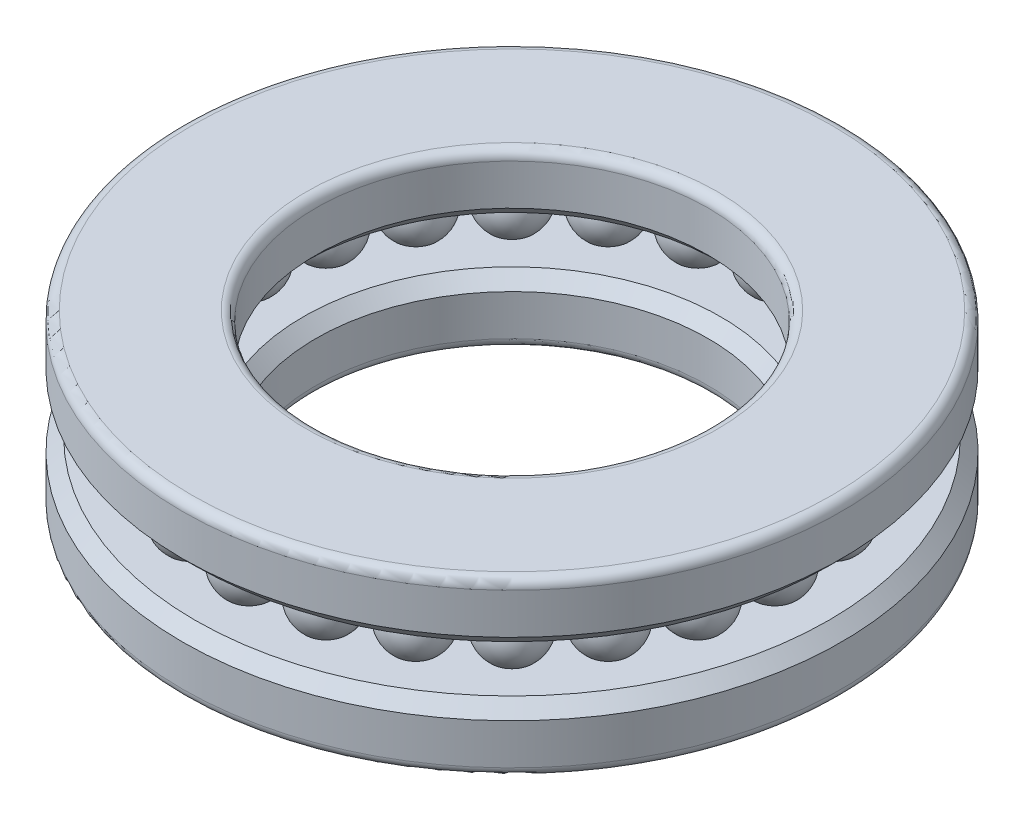
from build123d import *

# Parameters (mm, degrees)
SKETCH3_W         = 8.5
SKETCH3_H         = 4
CIRPATTERN2_COUNT = 24
FILLET1_R         = 0.6
CHAMFER1_SIZE     = 0.8


with BuildPart() as part:
    # Sketch1 → Revolve4 (revolve)
    with BuildSketch(Plane(origin=(0, 0, 0), x_dir=(0, 0, -1), z_dir=(1, 0, 0))):
        with BuildLine():
            Line((-16.75, 2), (-16.75, -2))
            ThreePointArc((-16.75, -2), (-18.75, 0), (-16.75, 2))
        make_face()
    revolve4 = revolve(axis=Axis((0, 0, 16.75), (0, 1, 0)))

    # Sketch3 → Revolve5 (revolve)
    with BuildSketch(Plane(origin=(0, 0, 0), x_dir=(0, 0, -1), z_dir=(1, 0, 0))):
        with Locations((-16.75, 3.5)):
            Rectangle(SKETCH3_W, SKETCH3_H)
        with Locations((-16.75, -3.5)):
            Rectangle(SKETCH3_W, SKETCH3_H)
    revolve(axis=Axis((0, 0, 0), (0, 1, 0)))

    # CirPattern2: Revolve4 ×24 about axis
    cirpattern2_axis = Axis((0, 5.5, 0), (0, -1, 0))
    for i in range(1, CIRPATTERN2_COUNT):
        add(revolve4.rotate(cirpattern2_axis, i * 360 / CIRPATTERN2_COUNT))

    # Fillet1
    fillet1_edges = [part.edges().sort_by_distance(p)[0] for p in [
        (0, -5.5, -12.5),
        (0, -5.5, -21),
        (0, 5.5, -12.5),
        (0, 5.5, -21),
    ]]
    fillet(fillet1_edges, radius=FILLET1_R)

    # Chamfer1
    chamfer1_edges = [part.edges().sort_by_distance(p)[0] for p in [
        (0, -1.5, -12.5),
        (0, 1.5, -12.5),
        (0, 1.5, -21),
        (0, -1.5, -21),
    ]]
    chamfer(chamfer1_edges, length=CHAMFER1_SIZE)


solid = part.part
